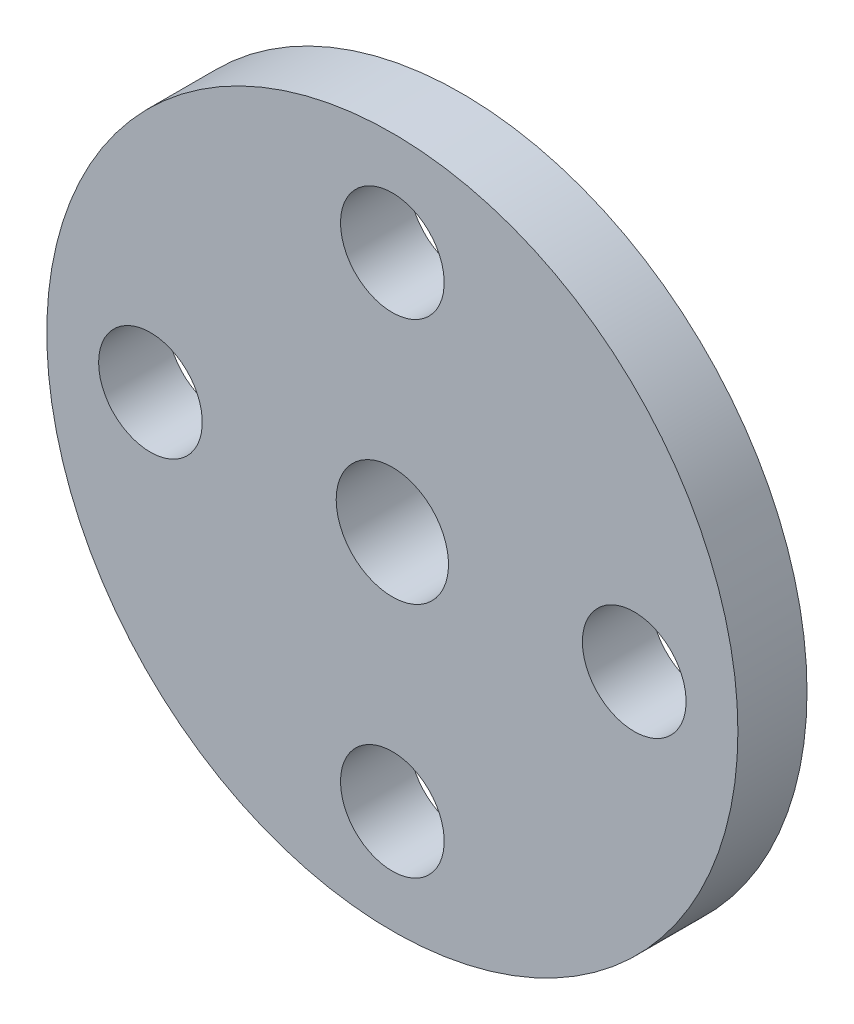
from build123d import *

# Parameters (mm, degrees)
SCHIZZO1_R                   = 10
ESTRUSIONE_ESTRUSIONE2_DEPTH = 2
FORO_3_0_3_1_D               = 3
SCHIZZO3_R                   = 4.5
ESTRUSIONE_ESTRUSIONE3_DEPTH = 2
SCHIZZO20_R                  = 1.625
TAGLIO_ESTRUSIONE1_DEPTH     = 15.696938457


with BuildPart() as part:
    # Schizzo1 → Estrusione-Estrusione2 (new body)
    with BuildSketch(Plane.XY):
        Circle(SCHIZZO1_R)
    extrude(amount=ESTRUSIONE_ESTRUSIONE2_DEPTH)

    # Foro Ø3.0 (3)-1 (through all)
    with Locations(Plane(origin=(7, 0, 0), x_dir=(-1, 0, 0), z_dir=(0, 0, -1))):
        with Locations((0, 0), (14, 0), (7, -7), (7, 7)):
            Hole(FORO_3_0_3_1_D / 2)

    # Schizzo3 → Estrusione-Estrusione3 (add)
    with BuildSketch(Plane.XY):
        Circle(SCHIZZO3_R)
    extrude(amount=-ESTRUSIONE_ESTRUSIONE3_DEPTH)

    # Schizzo20 → Taglio-Estrusione1 (cut, through all)
    with BuildSketch(Plane(origin=(0, 0, -2), x_dir=(-1, 0, 0), z_dir=(0, 0, -1))):
        Circle(SCHIZZO20_R)
    extrude(amount=-TAGLIO_ESTRUSIONE1_DEPTH, mode=Mode.SUBTRACT)


solid = part.part
